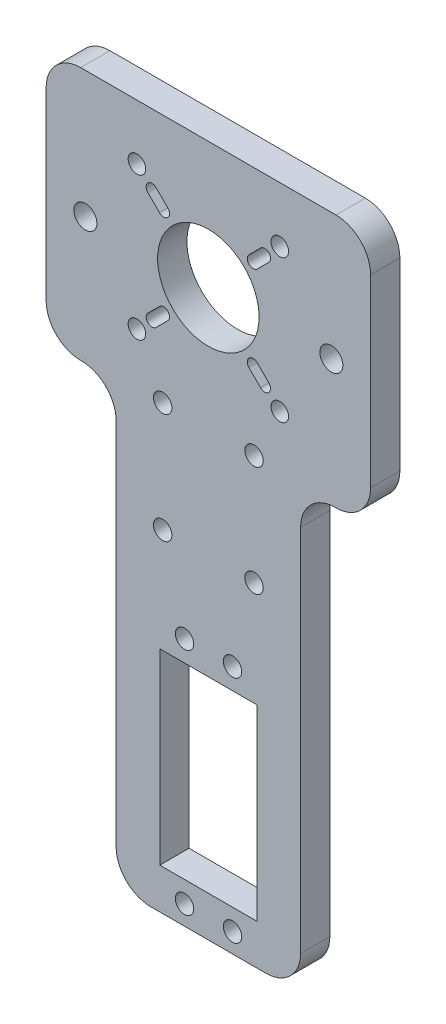
from build123d import *

# Parameters (mm, degrees)
SKETCH1_R           = 2
SKETCH1_W           = 21.082
SKETCH1_H           = 40.64
SKETCH1_R_2         = 1.905
SKETCH1_R_3         = 2.5
SKETCH1_R_4         = 11
BOSS_EXTRUDE1_DEPTH = 3.175
FILLET1_R           = 7.5


with BuildPart() as part:
    # Sketch1 → Boss-Extrude1 (new, symmetric)
    with BuildSketch(Plane.XY):
        Polygon((-20, 11), (-20, -84), (20, -84), (20, 11), (35.179, 11), (35.179, 66), (-35.179, 66), (-35.179, 11), align=None)
        with Locations((-5.1689, -79.784)):
            Circle(SKETCH1_R, mode=Mode.SUBTRACT)
        with Locations((-5.1689, -30)):
            Circle(SKETCH1_R, mode=Mode.SUBTRACT)
        with Locations((-9.906, -11.938)):
            Circle(SKETCH1_R, mode=Mode.SUBTRACT)
        with Locations((5.2451, -79.784)):
            Circle(SKETCH1_R, mode=Mode.SUBTRACT)
        with Locations((0, -54.892)):
            Rectangle(SKETCH1_W, SKETCH1_H, mode=Mode.SUBTRACT)
        with Locations((5.2451, -30)):
            Circle(SKETCH1_R, mode=Mode.SUBTRACT)
        with Locations((9.906, -11.938)):
            Circle(SKETCH1_R, mode=Mode.SUBTRACT)
        with Locations((-9.906, 11.938)):
            Circle(SKETCH1_R, mode=Mode.SUBTRACT)
        with Locations((-15.494, 23.006)):
            Circle(SKETCH1_R_2, mode=Mode.SUBTRACT)
        with BuildLine():
            ThreePointArc((-10.600944864, 29.695106361), (-8.804893639, 29.695106361), (-8.804893639, 27.899055136))
            Line((-8.804893639, 27.899055136), (-11.319365353, 25.384583423))
            ThreePointArc((-11.319365353, 25.384583423), (-13.115416577, 25.384583423), (-13.115416577, 27.180634647))
            Line((-13.115416577, 27.180634647), (-10.600944864, 29.695106361))
        make_face(mode=Mode.SUBTRACT)
        with Locations((-26.67, 38.5)):
            Circle(SKETCH1_R_3, mode=Mode.SUBTRACT)
        with Locations((-15.494, 53.994)):
            Circle(SKETCH1_R_2, mode=Mode.SUBTRACT)
        with BuildLine():
            ThreePointArc((-8.804893639, 49.100944864), (-8.804893639, 47.304893639), (-10.600944864, 47.304893639))
            Line((-10.600944864, 47.304893639), (-13.115416577, 49.819365353))
            ThreePointArc((-13.115416577, 49.819365353), (-13.115416577, 51.615416577), (-11.319365353, 51.615416577))
            Line((-11.319365353, 51.615416577), (-8.804893639, 49.100944864))
        make_face(mode=Mode.SUBTRACT)
        with Locations((9.906, 11.938)):
            Circle(SKETCH1_R, mode=Mode.SUBTRACT)
        with BuildLine():
            ThreePointArc((8.804893639, 27.899055136), (8.804893639, 29.695106361), (10.600944864, 29.695106361))
            Line((10.600944864, 29.695106361), (13.115416577, 27.180634647))
            ThreePointArc((13.115416577, 27.180634647), (13.115416577, 25.384583423), (11.319365353, 25.384583423))
            Line((11.319365353, 25.384583423), (8.804893639, 27.899055136))
        make_face(mode=Mode.SUBTRACT)
        with Locations((15.494, 23.006)):
            Circle(SKETCH1_R_2, mode=Mode.SUBTRACT)
        with Locations((0, 38.5)):
            Circle(SKETCH1_R_4, mode=Mode.SUBTRACT)
        with BuildLine():
            ThreePointArc((10.600944864, 47.304893639), (8.804893639, 47.304893639), (8.804893639, 49.100944864))
            Line((8.804893639, 49.100944864), (11.319365353, 51.615416577))
            ThreePointArc((11.319365353, 51.615416577), (13.115416577, 51.615416577), (13.115416577, 49.819365353))
            Line((13.115416577, 49.819365353), (10.600944864, 47.304893639))
        make_face(mode=Mode.SUBTRACT)
        with Locations((15.494, 53.994)):
            Circle(SKETCH1_R_2, mode=Mode.SUBTRACT)
        with Locations((26.67, 38.5)):
            Circle(SKETCH1_R_3, mode=Mode.SUBTRACT)
    extrude(amount=BOSS_EXTRUDE1_DEPTH, both=True)

    # Fillet1
    fillet1_edges = [part.edges().sort_by_distance(p)[0] for p in [
        (-20, -84, 0),
        (20, -84, 0),
        (20, 11, 0),
        (35.179, 11, 0),
        (35.179, 66, 0),
        (-20, 11, 0),
        (-35.179, 11, 0),
        (-35.179, 66, 0),
    ]]
    fillet(fillet1_edges, radius=FILLET1_R)


solid = part.part
